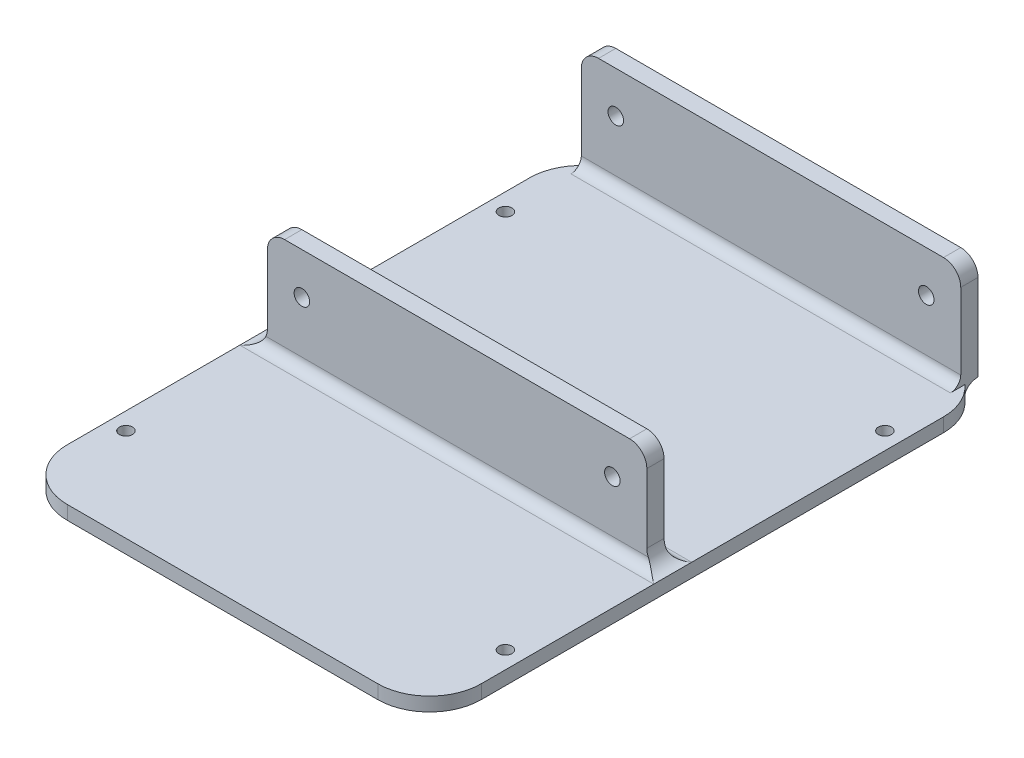
from build123d import *

# Parameters (mm, degrees)
SKETCH_1_W          = 120
SKETCH_1_H          = 164
SKETCH_1_R          = 1.9
EXTRUDE_1_DEPTH     = 4
FILLET_1_R          = 15
SKETCH_2_W          = 110
SKETCH_2_H          = 5
EXTRUDE_2_DEPTH     = 30
CUT_EXTRUDE_1_REACH = 179.91
SKETCH_3_R          = 2.25
FILLET_2_R          = 5
FILLET_3_R          = 3
FILLET_4_R          = 3


# Some blends are built 0.0001 mm under size
with BuildPart() as part:
    # Эскиз1 → Бобышка-Вытянуть1 (new body)
    with BuildSketch(Plane(origin=(0, 0, 0), x_dir=(1, 0, 0), z_dir=(0, 1, 0))):
        Rectangle(SKETCH_1_W, SKETCH_1_H)
        with Locations(Location((-55, 55, 0), (0, 0, 270))):
            Circle(SKETCH_1_R, mode=Mode.SUBTRACT)
        with Locations(Location((55, 55, 0), (0, 0, 90))):
            Circle(SKETCH_1_R, mode=Mode.SUBTRACT)
        with Locations(Location((55, -55, 0), (0, 0, 270))):
            Circle(SKETCH_1_R, mode=Mode.SUBTRACT)
        with Locations(Location((-55, -55, 0), (0, 0, 90))):
            Circle(SKETCH_1_R, mode=Mode.SUBTRACT)
    extrude(amount=EXTRUDE_1_DEPTH)

    # Скругление1
    fillet_1_edges = [part.edges().sort_by_distance(p)[0] for p in [
        (60, 2, 82),
        (-60, 2, 82),
        (-60, 2, -82),
        (60, 2, -82),
    ]]
    fillet(fillet_1_edges, radius=FILLET_1_R)

    # Эскиз2 → Бобышка-Вытянуть2 (add)
    with BuildSketch(Plane(origin=(0, 4, 0), x_dir=(1, 0, 0), z_dir=(0, 1, 0))):
        with Locations((0, 79.5)):
            Rectangle(SKETCH_2_W, SKETCH_2_H)
        with Locations((0, -11.5)):
            Rectangle(SKETCH_2_W, SKETCH_2_H)
    extrude(amount=EXTRUDE_2_DEPTH)

    # Вырез-Вытянуть1: up to this face of the body (flat: up to its plane)
    cut_extrude_1_end = Plane(part.part.faces().sort_by_distance((0, 19, 14))[0])
    # Эскиз3 → Вырез-Вытянуть1 (cut, up to the picked face)
    with BuildSketch(Plane.XY.offset(-82), mode=Mode.PRIVATE) as cut_extrude_1_sk1:
        with Locations(Location((-45, 22, 0), (0, 0, 180))):
            Circle(SKETCH_3_R)
    cut_extrude_1_tool1 = split(extrude(cut_extrude_1_sk1.sketch, amount=CUT_EXTRUDE_1_REACH, mode=Mode.PRIVATE), bisect_by=cut_extrude_1_end, keep=Keep.BOTH, mode=Mode.PRIVATE)
    # Эскиз3 → Вырез-Вытянуть1 (cut, up to the picked face)
    with BuildSketch(Plane.XY.offset(-82), mode=Mode.PRIVATE) as cut_extrude_1_sk2:
        with Locations(Location((45, 22, 0), (0, 0, 180))):
            Circle(SKETCH_3_R)
    cut_extrude_1_tool2 = split(extrude(cut_extrude_1_sk2.sketch, amount=CUT_EXTRUDE_1_REACH, mode=Mode.PRIVATE), bisect_by=cut_extrude_1_end, keep=Keep.BOTH, mode=Mode.PRIVATE)
    add(cut_extrude_1_tool1.solids().sort_by(Axis((-45, 22, -82), (0, 0, 1)))[0], mode=Mode.SUBTRACT)
    add(cut_extrude_1_tool2.solids().sort_by(Axis((45, 22, -82), (0, 0, 1)))[0], mode=Mode.SUBTRACT)

    # Скругление2
    fillet_2_edges = [part.edges().sort_by_distance(p)[0] for p in [
        (55, 34, -79.5),
        (-55, 34, -79.5),
        (-55, 4, 11.5),
        (55, 4, 11.5),
        (-55, 34, 11.5),
        (55, 34, 11.5),
    ]]
    fillet(fillet_2_edges, radius=FILLET_2_R - 0.0001)  # a hair under: the kernel refuses the full size

    # Скругление3
    fillet_3_edges = [part.edges().sort_by_distance(p)[0] for p in [
        (0, 4, -77),
        (0, 4, 14),
        (0, 4, 9),
    ]]
    fillet(fillet_3_edges, radius=FILLET_3_R)

    # Скругление4
    # the kernel refuses this fillet: 3 mm, written as the material it adds along each edge
    with BuildSketch(Plane(origin=(-45, 4, -67), x_dir=(0.7513290268597076, 0, -0.659927794079053), z_dir=(0.659927794079053, 0, 0.7513290268597076))) as fillet_4_piece_1_section:
        with BuildLine():
            CenterArc((15 + FILLET_4_R, -FILLET_4_R), FILLET_4_R, 90, 90)
            Line((15, -FILLET_4_R), (15, 0))
            Line((15, 0), (15 + FILLET_4_R, 0))
        make_face()
    fillet_4_piece_1 = revolve(axis=Axis((-45, 4, -67), (0, 1, 0)), revolution_arc=119.166321534, mode=Mode.PRIVATE)
    fillet_4_piece_1 = split(fillet_4_piece_1, bisect_by=Plane(origin=(-45, 4, -82), z_dir=(0, 0, 1)), keep=Keep.TOP, mode=Mode.PRIVATE)
    fillet_4_piece_1 = split(fillet_4_piece_1, bisect_by=Plane(origin=(-55, 4, -67), z_dir=(1, 0, 0)), keep=Keep.TOP, mode=Mode.PRIVATE)
    add(fillet_4_piece_1)
    with BuildSketch(Plane(origin=(45, 4, -67), x_dir=(0.9424122347792039, 0, -0.33445355393307824), z_dir=(0.33445355393307824, 0, 0.9424122347792039))) as fillet_4_piece_2_section:
        with BuildLine():
            CenterArc((15 + FILLET_4_R, -FILLET_4_R), FILLET_4_R, 90, 90)
            Line((15, -FILLET_4_R), (15, 0))
            Line((15, 0), (15 + FILLET_4_R, 0))
        make_face()
    fillet_4_piece_2 = revolve(axis=Axis((45, 4, -67), (0, 1, 0)), revolution_arc=119.166321534, mode=Mode.PRIVATE)
    fillet_4_piece_2 = split(fillet_4_piece_2, bisect_by=Plane(origin=(45, 4, -82), z_dir=(0, 0, 1)), keep=Keep.TOP, mode=Mode.PRIVATE)
    fillet_4_piece_2 = split(fillet_4_piece_2, bisect_by=Plane(origin=(55, 4, -67), z_dir=(-1, 0, 0)), keep=Keep.TOP, mode=Mode.PRIVATE)
    add(fillet_4_piece_2)


solid = part.part
